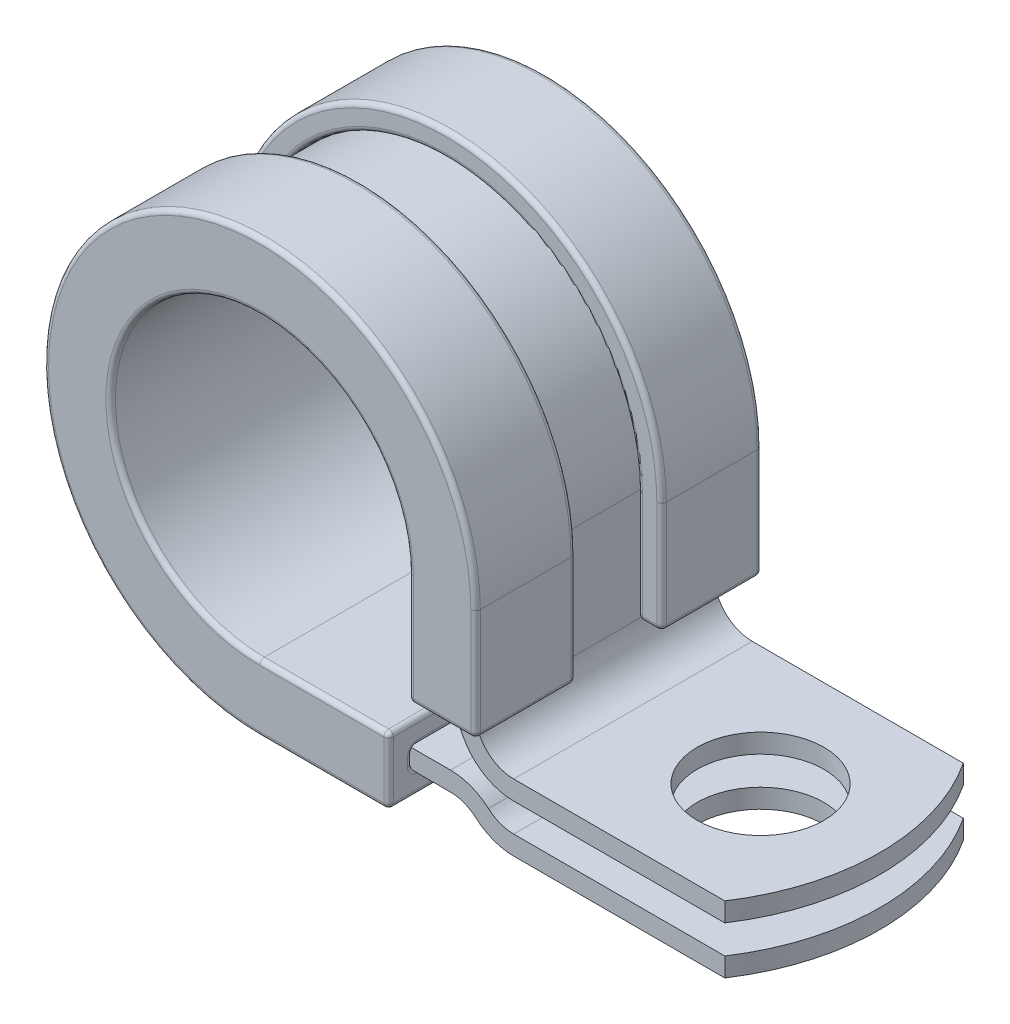
from build123d import *

# Parameters (mm, degrees)
BOSS_EXTRUDE1_DEPTH         = 6.35
SKETCH2_R                   = 3.3734375
CUT_EXTRUDE1_DEPTH          = 29.59340907
CUT_EXTRUDE3_DEPTH          = 29.59340907
CUT_EXTRUDE3_DEPTH_BACK     = 29.59340907
BOSS_EXTRUDE2_DEPTH         = 7.62
BOSS_EXTRUDE2_DEPTH_BACK    = 7.62
BODY_MOVE_COPY1_START       = -5.9055
BODY_MOVE_COPY1_OUTLINE_W   = 1.016
BODY_MOVE_COPY1_OUTLINE_H   = 12.7
BODY_MOVE_COPY1_DEPTH       = 5.9055
BODY_MOVE_COPY1_START_2     = -10.2235
BODY_MOVE_COPY1_2_OUTLINE_W = 1.016
BODY_MOVE_COPY1_2_OUTLINE_H = 12.7
BODY_MOVE_COPY1_2_DEPTH     = 0.254
BODY_MOVE_COPY1_START_3     = -8.9535
BODY_MOVE_COPY1_3_OUTLINE_R = 3.3734375
BODY_MOVE_COPY1_3_DEPTH     = 3.048
BODY_MOVE_COPY1_START_4     = -11.4935
BODY_MOVE_COPY1_4_OUTLINE_R = 3.3734375
BODY_MOVE_COPY1_4_DEPTH     = 2.286
BODY_MOVE_COPY1_5_OUTLINE_W = 1.016
BODY_MOVE_COPY1_5_OUTLINE_H = 12.7
BODY_MOVE_COPY1_5_DEPTH     = 9.2075
BODY_MOVE_COPY1_START_5     = -10.7315
BODY_MOVE_COPY1_6_OUTLINE_W = 1.016
BODY_MOVE_COPY1_6_OUTLINE_H = 12.7
BODY_MOVE_COPY1_6_DEPTH     = 1.524
BODY_MOVE_COPY1_START_6     = -6.35
BODY_MOVE_COPY1_7_DEPTH     = 12.7
BODY_MOVE_COPY1_8_DEPTH     = 12.7
CUT_EXTRUDE4_DEPTH          = 2.286
CUT_EXTRUDE4_DEPTH_BACK     = 2.286
FILLET1_R                   = 0.254


with BuildPart() as part:
    # Sketch1 → Boss-Extrude1 (new, symmetric)
    with BuildSketch(Plane.XY):
        with BuildLine():
            Line((0, -9.2075), (8.895395835, -9.2075))
            ThreePointArc((8.895395835, -9.2075), (9.973026569, -9.404357071), (10.911458334, -9.9695))
            ThreePointArc((10.911458334, -9.9695), (11.53707951, -10.346261952), (12.2555, -10.4775))
            Line((12.2555, -10.4775), (25.4, -10.4775))
            Line((25.4, -10.4775), (25.4, -11.4935))
            Line((25.4, -11.4935), (12.2555, -11.4935))
            ThreePointArc((12.2555, -11.4935), (11.177869265, -11.296642929), (10.239437501, -10.7315))
            ThreePointArc((10.239437501, -10.7315), (9.613816325, -10.354738048), (8.895395835, -10.2235))
            Line((8.895395835, -10.2235), (0, -10.2235))
            ThreePointArc((0, -10.2235), (-7.229106177, 7.229106177), (10.2235, 0))
            Line((10.2235, 0), (10.2235, -5.9055))
            ThreePointArc((10.2235, -5.9055), (10.818659021, -7.342340979), (12.2555, -7.9375))
            Line((12.2555, -7.9375), (25.4, -7.9375))
            Line((25.4, -7.9375), (25.4, -8.9535))
            Line((25.4, -8.9535), (12.2555, -8.9535))
            ThreePointArc((12.2555, -8.9535), (10.100238531, -8.060761469), (9.2075, -5.9055))
            Line((9.2075, -5.9055), (9.2075, 0))
            ThreePointArc((9.2075, 0), (-6.510685688, 6.510685688), (0, -9.2075))
        make_face()
    extrude(amount=BOSS_EXTRUDE1_DEPTH, both=True)

    # Sketch2 → Cut-Extrude1 (cut, through all)
    with BuildSketch(Plane(origin=(0, 0, 0), x_dir=(1, 0, 0), z_dir=(0, 1, 0))):
        with Locations(Location((19.05, 0, 0), (0, 0, 270))):
            Circle(SKETCH2_R)
    extrude(amount=-CUT_EXTRUDE1_DEPTH, mode=Mode.SUBTRACT)

    # Sketch4 → Cut-Extrude3 (cut, two sides: drawn at the far end of the back side and taken through both)
    with BuildSketch(Plane(origin=(0, 0, 0), x_dir=(1, 0, 0), z_dir=(0, 1, 0)).offset(-CUT_EXTRUDE3_DEPTH_BACK)):
        with BuildLine():
            Line((-21.676655752, 74.860344557), (23.495, 6.35))
            ThreePointArc((23.495, 6.35), (25.4, 0), (23.495, -6.35))
            Line((23.495, -6.35), (-21.676655752, -74.860344557))
            Line((-21.676655752, -74.860344557), (142.447026813, -74.860344557))
            Line((142.447026813, -74.860344557), (142.447026813, 74.860344557))
            Line((142.447026813, 74.860344557), (-21.676655752, 74.860344557))
        make_face()
    extrude(amount=CUT_EXTRUDE3_DEPTH + CUT_EXTRUDE3_DEPTH_BACK, mode=Mode.SUBTRACT)


with BuildPart() as body_2:
    # Sketch5 → Boss-Extrude2 (new, two sides: drawn at the far end of the back side and taken through both)
    with BuildSketch(Plane.XY.offset(-BOSS_EXTRUDE2_DEPTH_BACK)):
        with BuildLine():
            Line((7.9375, 0), (7.9375, -5.9055))
            Line((7.9375, -5.9055), (11.4935, -5.9055))
            Line((11.4935, -5.9055), (11.4935, 0))
            ThreePointArc((11.4935, 0), (-8.12713179, 8.12713179), (0, -11.4935))
            Line((0, -11.4935), (6.863395835, -11.4935))
            Line((6.863395835, -11.4935), (6.863395835, -7.9375))
            Line((6.863395835, -7.9375), (0, -7.9375))
            ThreePointArc((0, -7.9375), (-5.612660076, 5.612660076), (7.9375, 0))
        make_face()
    extrude(amount=BOSS_EXTRUDE2_DEPTH + BOSS_EXTRUDE2_DEPTH_BACK)


with BuildPart() as body_3:
    # Body-Move/Copy1: read off the stored shape, not the designer's step
    # Body-Move/Copy1 outline → Body-Move/Copy1 (new body)
    with BuildSketch(Plane(origin=(0, 0, 0), x_dir=(1, 0, 0), z_dir=(0, 1, 0)).offset(BODY_MOVE_COPY1_START)):
        with Locations((9.7155, 0)):
            Rectangle(BODY_MOVE_COPY1_OUTLINE_W, BODY_MOVE_COPY1_OUTLINE_H)
    extrude(amount=BODY_MOVE_COPY1_DEPTH)

    # Body-Move_Copy1 2 outline → Body-Move_Copy1 2 (add)
    with BuildSketch(Plane(origin=(0, 0, 0), x_dir=(1, 0, 0), z_dir=(0, 1, 0)).offset(BODY_MOVE_COPY1_START_2)):
        with Locations((9.7155, 0)):
            Rectangle(BODY_MOVE_COPY1_2_OUTLINE_W, BODY_MOVE_COPY1_2_OUTLINE_H)
    extrude(amount=BODY_MOVE_COPY1_2_DEPTH)

    # Body-Move_Copy1 3 outline → Body-Move_Copy1 3 (add)
    with BuildSketch(Plane(origin=(0, 0, 0), x_dir=(1, 0, 0), z_dir=(0, 1, 0)).offset(BODY_MOVE_COPY1_START_3)):
        with BuildLine():
            ThreePointArc((23.495, -6.35), (25.4, 0), (23.495, 6.35))
            Line((23.495, 6.35), (9.2075, 6.35))
            Line((9.2075, 6.35), (9.2075, -6.35))
            Line((9.2075, -6.35), (23.495, -6.35))
        make_face()
        with Locations((19.05, 0)):
            Circle(BODY_MOVE_COPY1_3_OUTLINE_R, mode=Mode.SUBTRACT)
    extrude(amount=BODY_MOVE_COPY1_3_DEPTH)

    # Body-Move_Copy1 4 outline → Body-Move_Copy1 4 (add)
    with BuildSketch(Plane(origin=(0, 0, 0), x_dir=(1, 0, 0), z_dir=(0, 1, 0)).offset(BODY_MOVE_COPY1_START_4)):
        with BuildLine():
            Line((10.2235, -6.35), (23.495, -6.35))
            ThreePointArc((23.495, -6.35), (25.4, 0), (23.495, 6.35))
            Line((23.495, 6.35), (10.2235, 6.35))
            Line((10.2235, 6.35), (10.2235, -6.35))
        make_face()
        with Locations((19.05, 0)):
            Circle(BODY_MOVE_COPY1_4_OUTLINE_R, mode=Mode.SUBTRACT)
    extrude(amount=BODY_MOVE_COPY1_4_DEPTH)

    # Body-Move_Copy1 5 outline → Body-Move_Copy1 5 (add)
    with BuildSketch(Plane(origin=(0, 0, 0), x_dir=(1, 0, 0), z_dir=(0, 1, 0))):
        with Locations((9.7155, 0)):
            Rectangle(BODY_MOVE_COPY1_5_OUTLINE_W, BODY_MOVE_COPY1_5_OUTLINE_H)
    extrude(amount=BODY_MOVE_COPY1_5_DEPTH)

    # Body-Move_Copy1 6 outline → Body-Move_Copy1 6 (add)
    with BuildSketch(Plane(origin=(0, 0, 0), x_dir=(1, 0, 0), z_dir=(0, 1, 0)).offset(BODY_MOVE_COPY1_START_5)):
        with Locations((9.7155, 0)):
            Rectangle(BODY_MOVE_COPY1_6_OUTLINE_W, BODY_MOVE_COPY1_6_OUTLINE_H)
    extrude(amount=BODY_MOVE_COPY1_6_DEPTH)

    # Body-Move_Copy1 7 outline → Body-Move_Copy1 7 (cut)
    with BuildSketch(Plane.XY.offset(BODY_MOVE_COPY1_START_6)):
        with BuildLine():
            ThreePointArc((10.2235, -5.9055), (10.818659021, -7.342340979), (12.2555, -7.9375))
            Line((12.2555, -7.9375), (27, -7.9375))
            Line((27, -7.9375), (27, -5.9055))
            Line((27, -5.9055), (10.2235, -5.9055))
        make_face()
        with BuildLine():
            ThreePointArc((9.2075, 4.443185344), (9.966263806, 2.278933523), (10.2235, 0))
            Line((10.2235, 0), (10.2235, 9.2075))
            Line((10.2235, 9.2075), (9.2075, 9.2075))
            Line((9.2075, 9.2075), (9.2075, 4.443185344))
        make_face()
        with BuildLine():
            Line((9.2075, -8.9535), (12.2555, -8.9535))
            ThreePointArc((12.2555, -8.9535), (10.100238531, -8.060761469), (9.2075, -5.9055))
            Line((9.2075, -5.9055), (9.2075, -8.9535))
        make_face()
        with BuildLine():
            Line((27, -10.4775), (27, -9.2075))
            Line((27, -9.2075), (9.2075, -9.2075))
            Line((9.2075, -9.2075), (9.2075, -9.223521275))
            ThreePointArc((9.2075, -9.223521275), (10.1177751, -9.463351556), (10.911458334, -9.9695))
            ThreePointArc((10.911458334, -9.9695), (11.53707951, -10.346261952), (12.2555, -10.4775))
            Line((12.2555, -10.4775), (27, -10.4775))
        make_face()
        with BuildLine():
            Line((9.2075, -10.247611809), (9.2075, -10.7315))
            Line((9.2075, -10.7315), (10.2235, -10.7315))
            Line((10.2235, -10.7315), (10.2235, -11.4935))
            Line((10.2235, -11.4935), (12.2555, -11.4935))
            ThreePointArc((12.2555, -11.4935), (11.177869265, -11.296642929), (10.239437501, -10.7315))
            ThreePointArc((10.239437501, -10.7315), (9.758090276, -10.415722215), (9.2075, -10.247611809))
        make_face()
    extrude(amount=BODY_MOVE_COPY1_7_DEPTH, mode=Mode.SUBTRACT)

    # Body-Move_Copy1 8 outline → Body-Move_Copy1 8 (add)
    with BuildSketch(Plane.XY.offset(BODY_MOVE_COPY1_START_6)):
        with BuildLine():
            Line((9.2075, 0), (9.2075, 4.443185344))
            ThreePointArc((9.2075, 4.443185344), (-8.658662068, 5.435763372), (0, -10.2235))
            Line((0, -10.2235), (8.895395835, -10.2235))
            ThreePointArc((8.895395835, -10.2235), (9.051912918, -10.22953692), (9.2075, -10.247611809))
            Line((9.2075, -10.247611809), (9.2075, -9.223521275))
            ThreePointArc((9.2075, -9.223521275), (9.051653388, -9.211507954), (8.895395835, -9.2075))
            Line((8.895395835, -9.2075), (0, -9.2075))
            ThreePointArc((0, -9.2075), (-6.510685688, 6.510685688), (9.2075, 0))
        make_face()
    extrude(amount=BODY_MOVE_COPY1_8_DEPTH)


with BuildPart() as body_2_1:
    add(body_2.part)

    # Combine1: cut body 3
    add(body_3.part, mode=Mode.SUBTRACT)

    # Sketch7 → Cut-Extrude4 (cut, two sides: drawn at the far end of the back side and taken through both)
    with BuildSketch(Plane.XY.offset(-CUT_EXTRUDE4_DEPTH_BACK)):
        with BuildLine():
            Line((9.2075, 0), (9.2075, -5.9055))
            Line((9.2075, -5.9055), (11.4935, -5.9055))
            Line((11.4935, -5.9055), (11.4935, 0))
            ThreePointArc((11.4935, 0), (-8.12713179, 8.12713179), (0, -11.4935))
            Line((0, -11.4935), (6.863395835, -11.4935))
            Line((6.863395835, -11.4935), (6.863395835, -9.2075))
            Line((6.863395835, -9.2075), (0, -9.2075))
            ThreePointArc((0, -9.2075), (-6.510685688, 6.510685688), (9.2075, 0))
        make_face()
    extrude(amount=CUT_EXTRUDE4_DEPTH + CUT_EXTRUDE4_DEPTH_BACK, mode=Mode.SUBTRACT)

    # Fillet1
    fillet1_edges = [body_2_1.edges().sort_by_distance(p)[0] for p in [
        (10.2235, -5.9055, -4.318),
        (6.863395835, -10.2235, -4.318),
        (11.4935, -5.9055, -4.953),
        (6.863395835, -11.4935, -4.953),
        (3.431697917, -10.2235, -2.286),
        (-8.658662068, 5.435763372, -2.286),
        (10.2235, -2.95275, -2.286),
        (6.863395835, -10.8585, -2.286),
        (6.863395835, -10.8585, 2.286),
        (3.431697917, -11.4935, 2.286),
        (3.431697917, -11.4935, -2.286),
        (-8.12713179, 8.12713179, 2.286),
        (-8.12713179, 8.12713179, -2.286),
        (11.4935, -2.95275, 2.286),
        (11.4935, -2.95275, -2.286),
        (10.8585, -5.9055, 2.286),
        (10.8585, -5.9055, -2.286),
        (3.431697917, -10.2235, 2.286),
        (-8.658662068, 5.435763372, 2.286),
        (10.2235, -2.95275, 2.286),
        (6.863395835, -7.9375, 0),
        (3.431697917, -7.9375, 7.62),
        (6.863395835, -11.4935, 4.953),
        (11.4935, -5.9055, 4.953),
        (7.9375, -5.9055, 0),
        (6.863395835, -9.7155, 7.62),
        (3.431697917, -11.4935, 7.62),
        (-8.12713179, 8.12713179, 7.62),
        (11.4935, -2.95275, 7.62),
        (9.7155, -5.9055, 7.62),
        (7.9375, -2.95275, 7.62),
        (-5.612660076, 5.612660076, 7.62),
        (7.9375, -2.95275, -7.62),
        (9.7155, -5.9055, -7.62),
        (11.4935, -2.95275, -7.62),
        (-8.12713179, 8.12713179, -7.62),
        (3.431697917, -11.4935, -7.62),
        (6.863395835, -9.7155, -7.62),
        (3.431697917, -7.9375, -7.62),
        (-5.612660076, 5.612660076, -7.62),
        (9.7155, -5.9055, -6.35),
        (9.7155, -5.9055, 6.35),
        (6.863395835, -9.2075, 0),
        (6.863395835, -10.2235, 4.318),
        (3.431697917, -10.2235, -6.35),
        (3.431697917, -9.2075, -6.35),
        (3.431697917, -9.2075, 6.35),
        (-6.510685688, 6.510685688, 6.35),
        (9.2075, -2.95275, 6.35),
        (10.2235, -2.95275, 6.35),
        (-8.658662068, 5.435763372, 6.35),
        (3.431697917, -10.2235, 6.35),
        (6.863395835, -9.7155, 6.35),
        (6.863395835, -9.7155, -6.35),
        (9.2075, -5.9055, 0),
        (10.2235, -2.95275, -6.35),
        (10.2235, -5.9055, 4.318),
        (-8.658662068, 5.435763372, -6.35),
        (-6.510685688, 6.510685688, -6.35),
        (9.2075, -2.95275, -6.35),
    ]]
    fillet(fillet1_edges, radius=FILLET1_R)


solid = Compound([part.part, body_2_1.part])
